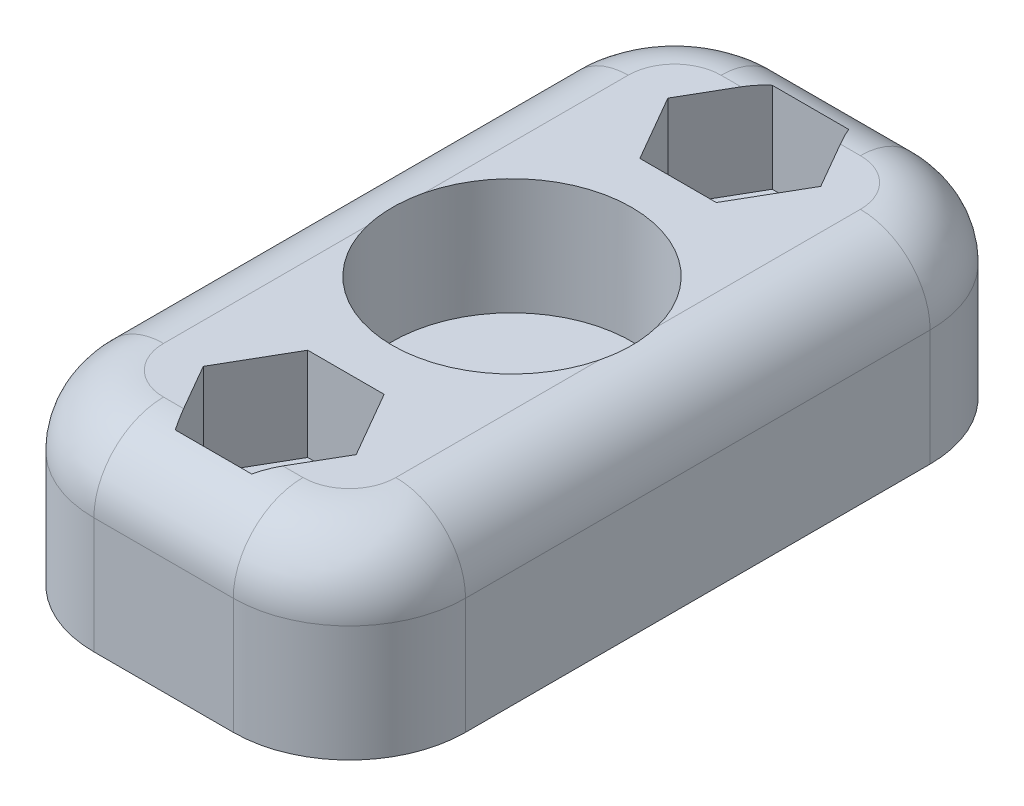
from build123d import *

# Parameters (mm, degrees)
ESQUISSE1_W             = 16
ESQUISSE1_H             = 30
ESQUISSE1_R             = 1.75
BOSS_EXTRU_1_DEPTH      = 8
ESQUISSE2_R             = 5.15
ENL_V_MAT_EXTRU_1_DEPTH = 5
CONG_1_R                = 5
ENL_V_MAT_EXTRU_2_DEPTH = 4
CONG_2_R                = 3


with BuildPart() as part:
    # Esquisse1 → Boss.-Extru.1 (new body)
    with BuildSketch(Plane(origin=(0, 0, 0), x_dir=(1, 0, 0), z_dir=(0, 1, 0))):
        with Locations((8, 15)):
            Rectangle(ESQUISSE1_W, ESQUISSE1_H)
        with Locations(Location((8, 25, 0), (0, 0, 270))):
            Circle(ESQUISSE1_R, mode=Mode.SUBTRACT)
        with Locations(Location((8, 5, 0), (0, 0, 90))):
            Circle(ESQUISSE1_R, mode=Mode.SUBTRACT)
    extrude(amount=BOSS_EXTRU_1_DEPTH)

    # Esquisse2 → Enlèv. mat.-Extru.1 (cut)
    with BuildSketch(Plane(origin=(0, 8, 0), x_dir=(1, 0, 0), z_dir=(0, 1, 0))):
        with Locations(Location((8, 15, 0), (0, 0, 270))):
            Circle(ESQUISSE2_R)
    extrude(amount=-ENL_V_MAT_EXTRU_1_DEPTH, mode=Mode.SUBTRACT)

    # Congé1
    cong_1_edges = [part.edges().sort_by_distance(p)[0] for p in [
        (0, 4, -30),
        (16, 4, -30),
        (16, 4, 0),
        (0, 4, 0),
    ]]
    fillet(cong_1_edges, radius=CONG_1_R)

    # Esquisse3 → Enlèv. mat.-Extru.2 (cut)
    with BuildSketch(Plane(origin=(0, 8, 0), x_dir=(1, 0, 0), z_dir=(0, 1, 0))):
        Polygon((6.354551733, 27.85), (9.645448267, 27.85), (11.290896534, 25), (9.645448267, 22.15), (6.354551733, 22.15), (4.709103466, 25), align=None)
        Polygon((6.354551733, 7.85), (9.645448267, 7.85), (11.290896534, 5), (9.645448267, 2.15), (6.354551733, 2.15), (4.709103466, 5), align=None)
    extrude(amount=-ENL_V_MAT_EXTRU_2_DEPTH, mode=Mode.SUBTRACT)

    # Congé2
    # the kernel refuses this fillet: 3 mm, written as the material it takes off along each edge
    with BuildSketch(Plane(origin=(5, 8, -5), x_dir=(0, 0, 1), z_dir=(1, 0, 0))) as cong_2_piece_1:
        with BuildLine():
            CenterArc((5 - CONG_2_R, CONG_2_R), CONG_2_R, 270, 90)
            Line((5 - CONG_2_R, 0), (5, 0))
            Line((5, 0), (5, CONG_2_R))
        make_face()
    revolve(axis=Axis((5, 8, -5), (0, -1, 0)), revolution_arc=90, mode=Mode.SUBTRACT)
    with BuildSketch(Plane(origin=(0, 8, -25), x_dir=(1, 0, 0), z_dir=(0, 0, 1)), Plane(origin=(16, 8, -5), x_dir=(-1, 0, 0), z_dir=(0, 0, -1))) as cong_2_piece_2:
        with BuildLine():
            CenterArc((CONG_2_R, -CONG_2_R), CONG_2_R, 90, 90)
            Line((0, -CONG_2_R), (0, 0))
            Line((0, 0), (CONG_2_R, 0))
        make_face()
    extrude(amount=20, mode=Mode.SUBTRACT)
    with BuildSketch(Plane(origin=(5, 8, -25), x_dir=(-1, 0, 0), z_dir=(0, 0, 1))) as cong_2_piece_3:
        with BuildLine():
            CenterArc((5 - CONG_2_R, CONG_2_R), CONG_2_R, 270, 90)
            Line((5, CONG_2_R), (5, 0))
            Line((5, 0), (5 - CONG_2_R, 0))
        make_face()
    revolve(axis=Axis((5, 8, -25), (0, -1, 0)), revolution_arc=90, mode=Mode.SUBTRACT)
    with BuildSketch(Plane(origin=(11, 8, -30), x_dir=(0, 0, 1), z_dir=(-1, 0, 0))) as cong_2_piece_4:
        with BuildLine():
            CenterArc((CONG_2_R, -CONG_2_R), CONG_2_R, 90, 90)
            Line((0, -CONG_2_R), (0, 0))
            Line((0, 0), (CONG_2_R, 0))
        make_face()
    extrude(amount=6, mode=Mode.SUBTRACT)
    with BuildSketch(Plane(origin=(11, 8, -25), x_dir=(1, 0, 0), z_dir=(0, 0, 1))) as cong_2_piece_5:
        with BuildLine():
            CenterArc((5 - CONG_2_R, -CONG_2_R), CONG_2_R, 0, 90)
            Line((5, -CONG_2_R), (5, 0))
            Line((5, 0), (5 - CONG_2_R, 0))
        make_face()
    revolve(axis=Axis((11, 8, -25), (0, 1, 0)), revolution_arc=90, mode=Mode.SUBTRACT)
    with BuildSketch(Plane(origin=(11, 8, -5), x_dir=(0, 0, 1), z_dir=(-1, 0, 0))) as cong_2_piece_6:
        with BuildLine():
            CenterArc((5 - CONG_2_R, -CONG_2_R), CONG_2_R, 0, 90)
            Line((5 - CONG_2_R, 0), (5, 0))
            Line((5, 0), (5, -CONG_2_R))
        make_face()
    revolve(axis=Axis((11, 8, -5), (0, 1, 0)), revolution_arc=90, mode=Mode.SUBTRACT)
    with BuildSketch(Plane(origin=(5, 8, 0), x_dir=(0, -1, 0), z_dir=(1, 0, 0))) as cong_2_piece_7:
        with BuildLine():
            CenterArc((CONG_2_R, CONG_2_R), CONG_2_R, 180, 90)
            Line((0, CONG_2_R), (0, 0))
            Line((0, 0), (CONG_2_R, 0))
        make_face()
    extrude(amount=6, mode=Mode.SUBTRACT)


solid = part.part
